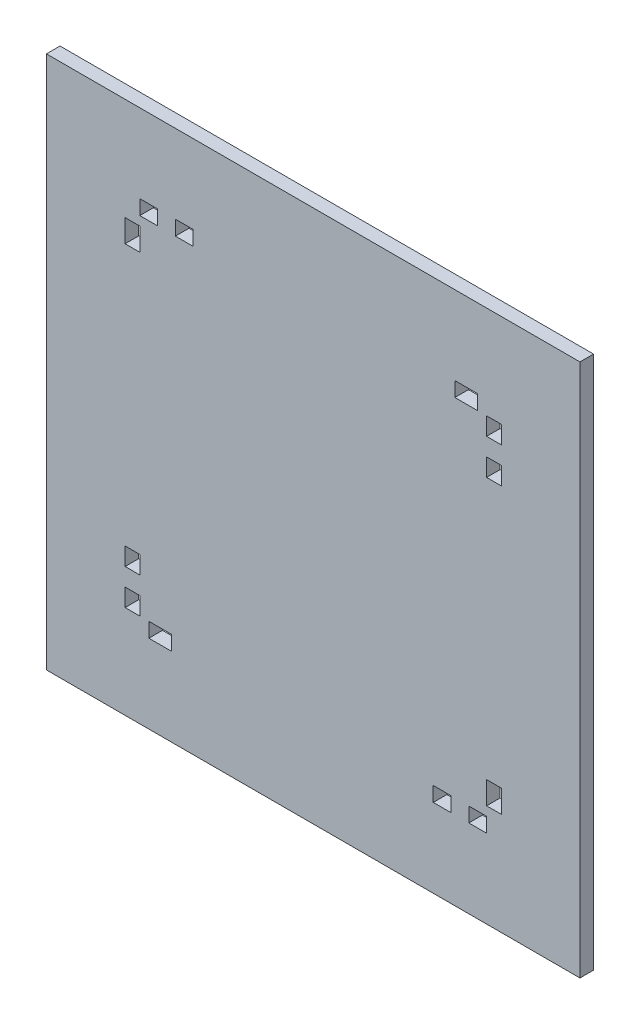
from build123d import *

# Parameters (mm, degrees)
SKETCH1_W             = 200
SKETCH1_H             = 200
BOSS_EXTRUDE1_DEPTH   = 5.1
CAVITY1_START         = 29.5
CAVITY1_OUTLINE_W     = 6.666666667
CAVITY1_OUTLINE_H     = 5.1
CAVITY1_OUTLINE_W_2   = 8.5
CAVITY1_DEPTH         = 5.5
CAVITY1_START_2       = 165
CAVITY1_2_OUTLINE_W   = 8.5
CAVITY1_2_OUTLINE_H   = 5.1
CAVITY1_2_OUTLINE_W_2 = 6.666666667
CAVITY1_2_DEPTH       = 5.5
CAVITY1_START_3       = 38.4
CAVITY1_3_OUTLINE_W   = 5.5
CAVITY1_3_OUTLINE_H   = 5.1
CAVITY1_3_DEPTH       = 8.5
CAVITY1_START_4       = 153.1
CAVITY1_4_OUTLINE_W   = 5.5
CAVITY1_4_OUTLINE_H   = 5.1
CAVITY1_4_DEPTH       = 8.5
CAVITY1_START_5       = 35
CAVITY1_5_OUTLINE_W   = 5.5
CAVITY1_5_OUTLINE_H   = 5.1
CAVITY1_5_DEPTH       = 6.666666667
CAVITY1_START_6       = 48.333333333
CAVITY1_6_OUTLINE_W   = 5.5
CAVITY1_6_OUTLINE_H   = 5.1
CAVITY1_6_DEPTH       = 6.666666667
CAVITY1_START_7       = 145
CAVITY1_7_OUTLINE_W   = 5.5
CAVITY1_7_OUTLINE_H   = 5.1
CAVITY1_7_DEPTH       = 6.666666667
CAVITY1_START_8       = 158.333333333
CAVITY1_8_OUTLINE_W   = 5.5
CAVITY1_8_OUTLINE_H   = 5.1
CAVITY1_8_DEPTH       = 6.666666667


# Read off the part's stored shape, not the designer's step: Cavity1
with BuildPart() as part:
    # Sketch1 → Boss-Extrude1 (new body)
    with BuildSketch(Plane.XY):
        with Locations((100, 100)):
            Rectangle(SKETCH1_W, SKETCH1_H)
    extrude(amount=BOSS_EXTRUDE1_DEPTH)

    # Cavity1 outline → Cavity1 (cut)
    with BuildSketch(Plane(origin=(0, 0, 0), x_dir=(1, 0, 0), z_dir=(0, 1, 0)).offset(CAVITY1_START)):
        with Locations((161.666666667, -2.55)):
            Rectangle(CAVITY1_OUTLINE_W, CAVITY1_OUTLINE_H)
        with Locations((148.333333334, -2.55)):
            Rectangle(CAVITY1_OUTLINE_W, CAVITY1_OUTLINE_H)
        with Locations((42.65, -2.55)):
            Rectangle(CAVITY1_OUTLINE_W_2, CAVITY1_OUTLINE_H)
    extrude(amount=CAVITY1_DEPTH, mode=Mode.SUBTRACT)

    # Cavity1 2 outline → Cavity1 2 (cut)
    with BuildSketch(Plane(origin=(0, 0, 0), x_dir=(1, 0, 0), z_dir=(0, 1, 0)).offset(CAVITY1_START_2)):
        with Locations((157.35, -2.55)):
            Rectangle(CAVITY1_2_OUTLINE_W, CAVITY1_2_OUTLINE_H)
        with Locations((51.666666667, -2.55)):
            Rectangle(CAVITY1_2_OUTLINE_W_2, CAVITY1_2_OUTLINE_H)
        with Locations((38.333333334, -2.55)):
            Rectangle(CAVITY1_2_OUTLINE_W_2, CAVITY1_2_OUTLINE_H)
    extrude(amount=CAVITY1_2_DEPTH, mode=Mode.SUBTRACT)

    # Cavity1 3 outline → Cavity1 3 (cut)
    with BuildSketch(Plane(origin=(0, 0, 0), x_dir=(1, 0, 0), z_dir=(0, 1, 0)).offset(CAVITY1_START_3)):
        with Locations((167.75, -2.55)):
            Rectangle(CAVITY1_3_OUTLINE_W, CAVITY1_3_OUTLINE_H)
    extrude(amount=CAVITY1_3_DEPTH, mode=Mode.SUBTRACT)

    # Cavity1 4 outline → Cavity1 4 (cut)
    with BuildSketch(Plane(origin=(0, 0, 0), x_dir=(1, 0, 0), z_dir=(0, 1, 0)).offset(CAVITY1_START_4)):
        with Locations((32.25, -2.55)):
            Rectangle(CAVITY1_4_OUTLINE_W, CAVITY1_4_OUTLINE_H)
    extrude(amount=CAVITY1_4_DEPTH, mode=Mode.SUBTRACT)

    # Cavity1 5 outline → Cavity1 5 (cut)
    with BuildSketch(Plane(origin=(0, 0, 0), x_dir=(1, 0, 0), z_dir=(0, 1, 0)).offset(CAVITY1_START_5)):
        with Locations((32.25, -2.55)):
            Rectangle(CAVITY1_5_OUTLINE_W, CAVITY1_5_OUTLINE_H)
    extrude(amount=CAVITY1_5_DEPTH, mode=Mode.SUBTRACT)

    # Cavity1 6 outline → Cavity1 6 (cut)
    with BuildSketch(Plane(origin=(0, 0, 0), x_dir=(1, 0, 0), z_dir=(0, 1, 0)).offset(CAVITY1_START_6)):
        with Locations((32.25, -2.55)):
            Rectangle(CAVITY1_6_OUTLINE_W, CAVITY1_6_OUTLINE_H)
    extrude(amount=CAVITY1_6_DEPTH, mode=Mode.SUBTRACT)

    # Cavity1 7 outline → Cavity1 7 (cut)
    with BuildSketch(Plane(origin=(0, 0, 0), x_dir=(1, 0, 0), z_dir=(0, 1, 0)).offset(CAVITY1_START_7)):
        with Locations((167.75, -2.55)):
            Rectangle(CAVITY1_7_OUTLINE_W, CAVITY1_7_OUTLINE_H)
    extrude(amount=CAVITY1_7_DEPTH, mode=Mode.SUBTRACT)

    # Cavity1 8 outline → Cavity1 8 (cut)
    with BuildSketch(Plane(origin=(0, 0, 0), x_dir=(1, 0, 0), z_dir=(0, 1, 0)).offset(CAVITY1_START_8)):
        with Locations((167.75, -2.55)):
            Rectangle(CAVITY1_8_OUTLINE_W, CAVITY1_8_OUTLINE_H)
    extrude(amount=CAVITY1_8_DEPTH, mode=Mode.SUBTRACT)


solid = part.part
